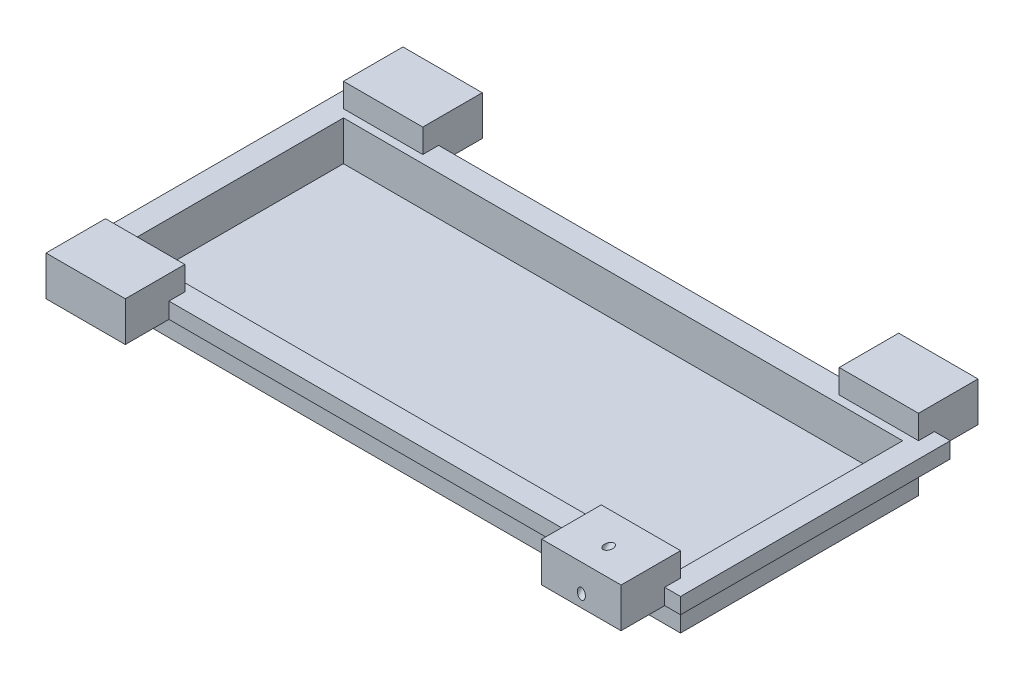
from build123d import *

# Parameters (mm, degrees)
SKETCH1_W               = 145
SKETCH1_H               = 60
SKETCH1_W_2             = 141
SKETCH1_H_2             = 56
BOSS_EXTRUDE1_DEPTH     = 10
SKETCH2_W               = 145
SKETCH2_H               = 60
BOSS_EXTRUDE2_DEPTH     = 2
SKETCH3_W               = 153
SKETCH3_H               = 68
SKETCH3_W_2             = 145
SKETCH3_H_2             = 60
BOSS_EXTRUDE3_DEPTH     = 4
CHAMFER1_SIZE           = 4
BOSS_EXTRUDE4_START     = -4
SKETCH4_W               = 20
SKETCH4_H               = 15
BOSS_EXTRUDE4_DEPTH     = 10
CUT_EXTRUDE2_DEPTH      = 102.600935035
CUT_EXTRUDE2_DEPTH_BACK = 102.600935035
SKETCH6_R               = 1


with BuildPart() as part:
    # Sketch1 → Boss-Extrude1 (new body)
    with BuildSketch(Plane(origin=(0, 0, 0), x_dir=(1, 0, 0), z_dir=(0, 1, 0))):
        Rectangle(SKETCH1_W, SKETCH1_H)
        Rectangle(SKETCH1_W_2, SKETCH1_H_2, mode=Mode.SUBTRACT)
    extrude(amount=BOSS_EXTRUDE1_DEPTH)

    # Sketch2 → Boss-Extrude2 (add)
    with BuildSketch(Plane.XZ):
        Rectangle(SKETCH2_W, SKETCH2_H)
    extrude(amount=BOSS_EXTRUDE2_DEPTH)

    # Sketch3 → Boss-Extrude3 (add)
    with BuildSketch(Plane(origin=(0, 10, 0), x_dir=(1, 0, 0), z_dir=(0, 1, 0))):
        Rectangle(SKETCH3_W, SKETCH3_H)
        Rectangle(SKETCH3_W_2, SKETCH3_H_2, mode=Mode.SUBTRACT)
    extrude(amount=-BOSS_EXTRUDE3_DEPTH)

    # Chamfer1
    chamfer1_edges = [part.edges().sort_by_distance(p)[0] for p in [
        (-72.5, 6, 0),
        (0, 6, 30),
        (72.5, 6, 0),
        (0, 6, -30),
    ]]
    chamfer(chamfer1_edges, length=CHAMFER1_SIZE - 0.0001)  # a hair under: the kernel refuses the full size

    # Sketch4 → Boss-Extrude4 (add)
    with BuildSketch(Plane(origin=(0, 10, 0), x_dir=(1, 0, 0), z_dir=(0, 1, 0)).offset(BOSS_EXTRUDE4_START)):
        with Locations((-62.5, 37.5)):
            Rectangle(SKETCH4_W, SKETCH4_H)
        with Locations((-62.5, -37.5)):
            Rectangle(SKETCH4_W, SKETCH4_H)
        with Locations((62.5, -37.5)):
            Rectangle(SKETCH4_W, SKETCH4_H)
        with Locations((62.5, 37.5)):
            Rectangle(SKETCH4_W, SKETCH4_H)
    extrude(amount=BOSS_EXTRUDE4_DEPTH)

    # Sketch6 → Cut-Extrude2 (cut, two sides: drawn at the far end of the back side and taken through both)
    with BuildSketch(Plane(origin=(0, -14.5, 14.5), x_dir=(1, 0, 0), z_dir=(0, 0.7071067811865464, -0.7071067811865488)).offset(-CUT_EXTRUDE2_DEPTH_BACK)):
        with Locations(Location((62.5, -38.261881076, 0), (0, 0, 270))):
            Circle(SKETCH6_R)
    extrude(amount=CUT_EXTRUDE2_DEPTH + CUT_EXTRUDE2_DEPTH_BACK, mode=Mode.SUBTRACT)


solid = part.part
